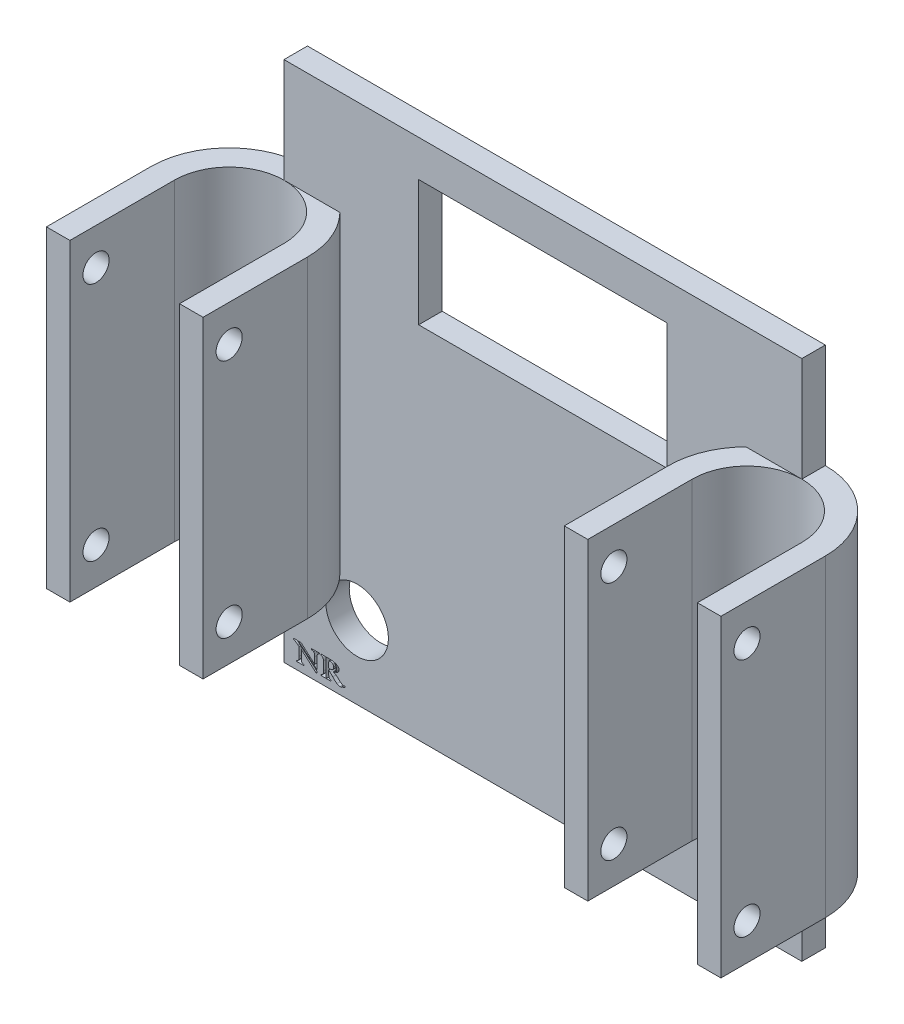
from build123d import *

# Parameters (mm, degrees)
SKETCH4_R               = 15
SKETCH4_R_2             = 10.5
BOSS_EXTRUDE3_DEPTH     = 60
BOSS_EXTRUDE3_2_DEPTH   = 60
BOSS_EXTRUDE4_START     = 30
SKETCH5_W               = 99.189569717
SKETCH5_H               = 4.5
BOSS_EXTRUDE4_DEPTH     = 50
SKETCH6_W               = 135.750478206
SKETCH6_H               = 17.20014076
CUT_EXTRUDE1_DEPTH      = 95
SKETCH9_W               = 4.5
SKETCH9_H               = 20
BOSS_EXTRUDE5_DEPTH     = 60
CUT_EXTRUDE4_DEPTH      = 141.85190035
CUT_EXTRUDE4_DEPTH_BACK = 141.85190035
SKETCH10_R              = 2.5
SKETCH11_W              = 99.189569717
SKETCH11_H              = 4.5
BOSS_EXTRUDE6_DEPTH     = 50
CUT_EXTRUDE6_START      = -2
CUT_EXTRUDE6_DEPTH      = 2
SKETCH14_R              = 6
CUT_EXTRUDE7_DEPTH      = 144.75067947
SKETCH15_W              = 47.6
SKETCH15_H              = 24.1
CUT_EXTRUDE8_DEPTH      = 144.75067947


# Read off the part's stored shape, not the designer's step: Cut-Extrude6
with BuildPart() as part:
    # Sketch4 → Boss-Extrude3 (new body)
    with BuildSketch(Plane(origin=(0, 0, 0), x_dir=(1, 0, 0), z_dir=(0, 1, 0))):
        with Locations(Location((0, 0, 0), (0, 0, 270))):
            Circle(SKETCH4_R)
        with Locations(Location((0, 0, 0), (0, 0, 270))):
            Circle(SKETCH4_R_2, mode=Mode.SUBTRACT)
    extrude(amount=BOSS_EXTRUDE3_DEPTH)



with BuildPart() as body_2:
    # Sketch4 → Boss-Extrude3 2 (new body)
    with BuildSketch(Plane(origin=(0, 0, 0), x_dir=(1, 0, 0), z_dir=(0, 1, 0))):
        with Locations(Location((99.189569717, 0, 0), (0, 0, 270))):
            Circle(SKETCH4_R)
        with Locations(Location((99.189569717, 0, 0), (0, 0, 270))):
            Circle(SKETCH4_R_2, mode=Mode.SUBTRACT)
    extrude(amount=BOSS_EXTRUDE3_2_DEPTH)


with BuildPart() as part_1:
    add(part.part)

    add(body_2.part)  # Boss-Extrude4 merges body 2
    # Sketch5 → Boss-Extrude4 (add)
    with BuildSketch(Plane(origin=(0, 0, 0), x_dir=(1, 0, 0), z_dir=(0, 1, 0)).offset(BOSS_EXTRUDE4_START)):
        with Locations((49.594784859, 12.75)):
            Rectangle(SKETCH5_W, SKETCH5_H)
    extrude(amount=BOSS_EXTRUDE4_DEPTH)

    # Sketch6 → Cut-Extrude1 (cut)
    with BuildSketch(Plane(origin=(0, 0, 0), x_dir=(1, 0, 0), z_dir=(0, 1, 0))):
        with Locations((50.045783125, -8.60007038)):
            Rectangle(SKETCH6_W, SKETCH6_H)
    extrude(amount=CUT_EXTRUDE1_DEPTH, mode=Mode.SUBTRACT)

    # Sketch9 → Boss-Extrude5 (add)
    with BuildSketch(Plane(origin=(0, 0, 0), x_dir=(1, 0, 0), z_dir=(0, 1, 0))):
        with Locations((-12.75, -10)):
            Rectangle(SKETCH9_W, SKETCH9_H)
        with Locations((12.75, -10)):
            Rectangle(SKETCH9_W, SKETCH9_H)
        with Locations((86.439569717, -10)):
            Rectangle(SKETCH9_W, SKETCH9_H)
        with Locations((111.939569717, -10)):
            Rectangle(SKETCH9_W, SKETCH9_H)
    extrude(amount=BOSS_EXTRUDE5_DEPTH)

    # Sketch10 → Cut-Extrude4 (cut, two sides: drawn at the far end of the back side and taken through both)
    with BuildSketch(Plane(origin=(0, 0, 0), x_dir=(0, 0, -1), z_dir=(1, 0, 0)).offset(-CUT_EXTRUDE4_DEPTH_BACK)):
        with Locations((-15, 7)):
            Circle(SKETCH10_R)
        with Locations((-15, 53)):
            Circle(SKETCH10_R)
    extrude(amount=CUT_EXTRUDE4_DEPTH + CUT_EXTRUDE4_DEPTH_BACK, mode=Mode.SUBTRACT)

    # Sketch11 → Boss-Extrude6 (add)
    with BuildSketch(Plane(origin=(0, 30, 0), x_dir=(1, 0, 0), z_dir=(0, 1, 0))):
        with Locations((49.594784859, 12.75)):
            Rectangle(SKETCH11_W, SKETCH11_H)
    extrude(amount=-BOSS_EXTRUDE6_DEPTH)

    # Cut-Extrude6 outline → Cut-Extrude6 (cut)
    # profile 1 of 5: a face of its own
    with BuildSketch(Plane.XY.offset(-10.5).offset(CUT_EXTRUDE6_START)):
        with BuildLine():
            add(Edge.make_bspline(
                [(6.3515625, -15.60453826), (6.345631349, -15.631157613), (6.332487853, -15.690146389), (6.320396673, -15.789771031), (6.314484465, -15.908498662), (6.313192302, -15.994179811), (6.3125, -16.040085135)],
                knots=[0, 0, 0, 0, 0.186590684, 0.413486984, 0.685764369, 1, 1, 1, 1], degree=3))
            add(Edge.make_bspline(
                [(6.483398437, -15.369186698), (6.46952702, -15.383075067), (6.440686672, -15.41195066), (6.405732103, -15.466705429), (6.374133474, -15.531010922), (6.359338849, -15.57920598), (6.3515625, -15.60453826)],
                knots=[0, 0, 0, 0, 0.215051393, 0.44711775, 0.709394108, 1, 1, 1, 1], degree=3))
            add(Edge.make_bspline(
                [(6.8203125, -15.232467948), (6.785601719, -15.238073767), (6.719446671, -15.248757859), (6.628003017, -15.278147165), (6.548443545, -15.316865), (6.504660563, -15.352083636), (6.483398437, -15.369186698)],
                knots=[0, 0, 0, 0, 0.285568369, 0.544262867, 0.778682495, 1, 1, 1, 1], degree=3))
            Line((6.8203125, -15.232467948), (6.8203125, -15.059616385))
            Line((6.8203125, -15.059616385), (5.2890625, -15.059616385))
            Line((5.2890625, -15.059616385), (5.2890625, -15.238327323))
            add(Edge.make_bspline(
                [(5.666992187, -15.379928885), (5.644052863, -15.363450717), (5.59524696, -15.328391625), (5.506543527, -15.290923841), (5.403364725, -15.259639419), (5.328635231, -15.245705813), (5.2890625, -15.238327323)],
                knots=[0, 0, 0, 0, 0.207298771, 0.441050639, 0.704010409, 1, 1, 1, 1], degree=3))
            add(Edge.make_bspline(
                [(5.831054687, -15.629928885), (5.823818555, -15.605789683), (5.809404864, -15.557706673), (5.771655847, -15.492254301), (5.725816074, -15.430860575), (5.686900719, -15.397166358), (5.666992187, -15.379928885)],
                knots=[0, 0, 0, 0, 0.247818207, 0.493630433, 0.740948671, 1, 1, 1, 1], degree=3))
            add(Edge.make_bspline(
                [(5.875, -16.122116385), (5.874429575, -16.071646168), (5.873357877, -15.976824163), (5.865830277, -15.844178892), (5.853502978, -15.730025017), (5.838114479, -15.661408245), (5.831054687, -15.629928885)],
                knots=[0, 0, 0, 0, 0.305688975, 0.574319731, 0.8047104, 1, 1, 1, 1], degree=3))
            Line((5.875, -16.122116385), (5.875, -17.378952323))
            Line((5.875, -17.378952323), (3.265625, -15.059616385))
            Line((3.265625, -15.059616385), (2.764648437, -15.059616385))
            Line((2.764648437, -15.059616385), (6.3125, -18.035202323))
            Line((6.3125, -18.035202323), (6.3125, -16.040085135))
        make_face()
    # profile 2 of 5: a face of its own
    with BuildSketch(Plane.XY.offset(-10.5).offset(CUT_EXTRUDE6_START)):
        with BuildLine():
            add(Edge.make_bspline(
                [(8.5625, -17.669967948), (8.563397151, -17.726387964), (8.565085748, -17.832580456), (8.588343195, -17.981860375), (8.622650483, -18.111816294), (8.673977879, -18.221796105), (8.739482285, -18.312489061), (8.822773417, -18.380334095), (8.919308009, -18.430694082), (8.991282612, -18.44424482), (9.028320312, -18.451217948)],
                knots=[0, 0, 0, 0, 0.168548207, 0.317237666, 0.450688369, 0.569132173, 0.678356261, 0.782057148, 0.887847914, 1, 1, 1, 1], degree=3))
            Line((8.5625, -17.669967948), (8.5625, -16.977585135))
            add(Edge.make_bspline(
                [(8.784179687, -17.177780448), (8.755584471, -17.155634395), (8.704531752, -17.116095745), (8.640213978, -17.059580229), (8.592253218, -17.017205399), (8.571004036, -16.98890936), (8.5625, -16.977585135)],
                knots=[0, 0, 0, 0, 0.362010432, 0.646318482, 0.858454774, 1, 1, 1, 1], degree=3))
            add(Edge.make_bspline(
                [(9.344726562, -17.724655448), (9.314451662, -17.692756406), (9.255964997, -17.631132138), (9.171673618, -17.542261669), (9.09222344, -17.462185913), (9.019169286, -17.389708939), (8.95165946, -17.325730377), (8.891584973, -17.268145617), (8.835478358, -17.220842227), (8.80045926, -17.191446052), (8.784179687, -17.177780448)],
                knots=[0, 0, 0, 0, 0.168359555, 0.325245947, 0.468878017, 0.600174077, 0.719160284, 0.824958423, 0.918627204, 1, 1, 1, 1], degree=3))
            add(Edge.make_bspline(
                [(10.137695312, -18.450241385), (10.114123667, -18.433496406), (10.063899127, -18.397817567), (9.986651862, -18.336911868), (9.903027037, -18.265083599), (9.810231311, -18.183762537), (9.709173023, -18.088761736), (9.596899982, -17.980640597), (9.474238374, -17.857501923), (9.389237021, -17.77031196), (9.344726562, -17.724655448)],
                knots=[0, 0, 0, 0, 0.080583134, 0.171699974, 0.274050387, 0.387827793, 0.515579673, 0.660597754, 0.82227401, 1, 1, 1, 1], degree=3))
            add(Edge.make_bspline(
                [(10.723632812, -18.622116385), (10.669088822, -18.620185), (10.562578647, -18.616413508), (10.408895777, -18.583096135), (10.265364173, -18.530087602), (10.180208763, -18.47683), (10.137695312, -18.450241385)],
                knots=[0, 0, 0, 0, 0.263710864, 0.51495848, 0.757845231, 1, 1, 1, 1], degree=3))
            Line((10.723632812, -18.622116385), (11.067382812, -18.622116385))
            Line((11.067382812, -18.622116385), (11.067382813, -18.437399493))
            add(Edge.make_bspline(
                [(11.251953125, -18.459030448), (11.206802868, -18.456719383), (11.14469187, -18.453540165), (11.083877454, -18.441304684), (11.067382813, -18.437399493)],
                knots=[0, 0, 0, 0, 0.229231469, 0.315342507, 0.315342507, 0.315342507, 0.315342507], degree=3))
            add(Edge.make_bspline(
                [(11.734375, -18.239303885), (11.719530306, -18.256994046), (11.690432532, -18.291669351), (11.639417911, -18.335689768), (11.585764933, -18.374120034), (11.527679402, -18.406099588), (11.464200022, -18.428976607), (11.397333756, -18.446953761), (11.325783387, -18.456416283), (11.277041826, -18.458142113), (11.251953125, -18.459030448)],
                knots=[0, 0, 0, 0, 0.125855176, 0.246694577, 0.36648455, 0.485733112, 0.607171829, 0.733864423, 0.863012266, 1, 1, 1, 1], degree=3))
            Line((11.734375, -18.239303885), (11.693359375, -18.107467948))
            add(Edge.make_bspline(
                [(11.432617187, -18.16313201), (11.445984683, -18.162006144), (11.478450625, -18.159271727), (11.535282332, -18.148907004), (11.608659675, -18.130614531), (11.663119404, -18.115731873), (11.693359375, -18.107467948)],
                knots=[0, 0, 0, 0, 0.15063036, 0.365839412, 0.647868288, 1, 1, 1, 1], degree=3))
            add(Edge.make_bspline(
                [(10.491210937, -17.55766326), (10.540243032, -17.605347402), (10.633936301, -17.696464927), (10.774643692, -17.818946171), (10.904995171, -17.924577194), (11.027427959, -18.009931152), (11.140424434, -18.07775467), (11.245299338, -18.124873645), (11.341308128, -18.156367809), (11.403449068, -18.160971228), (11.432617187, -18.16313201)],
                knots=[0, 0, 0, 0, 0.179896186, 0.343755691, 0.490604525, 0.621025589, 0.736174311, 0.836603195, 0.923303743, 1, 1, 1, 1], degree=3))
            add(Edge.make_bspline(
                [(9.838867187, -16.996139823), (9.859767943, -17.010692561), (9.903964189, -17.041465438), (9.972389596, -17.092132912), (10.045591782, -17.151250339), (10.124647777, -17.217367705), (10.20860109, -17.292032972), (10.298099792, -17.373773928), (10.393178532, -17.462957327), (10.457764016, -17.525351272), (10.491210937, -17.55766326)],
                knots=[0, 0, 0, 0, 0.088657667, 0.187473416, 0.296313356, 0.416159235, 0.546215408, 0.687388189, 0.838107544, 1, 1, 1, 1], degree=3))
            add(Edge.make_bspline(
                [(9.412109375, -16.857467948), (9.449079361, -16.85983895), (9.523326381, -16.864600647), (9.632025876, -16.893890065), (9.73929676, -16.935041492), (9.805242518, -16.975507078), (9.838867187, -16.996139823)],
                knots=[0, 0, 0, 0, 0.244059444, 0.490145877, 0.740033674, 1, 1, 1, 1], degree=3))
            add(Edge.make_bspline(
                [(9.98828125, -16.02641326), (9.98685611, -16.081875922), (9.984137099, -16.187692577), (9.956691244, -16.33741571), (9.911760326, -16.469727256), (9.849371555, -16.585266616), (9.766340762, -16.682285926), (9.664630887, -16.760166234), (9.545450468, -16.821065128), (9.457598062, -16.845049297), (9.412109375, -16.857467948)],
                knots=[0, 0, 0, 0, 0.150141985, 0.286454384, 0.410571848, 0.527416482, 0.640009802, 0.753795419, 0.87251888, 1, 1, 1, 1], degree=3))
            add(Edge.make_bspline(
                [(9.734375, -15.326217948), (9.754668044, -15.351606955), (9.794812378, -15.401832281), (9.846812014, -15.482106978), (9.88954581, -15.565940017), (9.92647552, -15.651694819), (9.953346418, -15.741656127), (9.97424404, -15.833879925), (9.986033235, -15.929428109), (9.987526024, -15.993830881), (9.98828125, -16.02641326)],
                knots=[0, 0, 0, 0, 0.128134595, 0.253479859, 0.376355154, 0.498908118, 0.6211379, 0.74604191, 0.871518591, 1, 1, 1, 1], degree=3))
            add(Edge.make_bspline(
                [(8.987304687, -15.059616385), (9.028685013, -15.060211873), (9.108726652, -15.061363721), (9.224280495, -15.074549033), (9.331324792, -15.094434534), (9.429680846, -15.123581097), (9.519216959, -15.162103009), (9.600487091, -15.207668979), (9.673455694, -15.261575146), (9.714134947, -15.304740787), (9.734375, -15.326217948)],
                knots=[0, 0, 0, 0, 0.151720092, 0.293470983, 0.426016387, 0.550679314, 0.668896719, 0.78278972, 0.891926543, 1, 1, 1, 1], degree=3))
            Line((8.987304687, -15.059616385), (8.091796875, -15.059616385))
            Line((8.091796875, -15.059616385), (8.091796875, -18.622116385))
            Line((8.091796875, -18.622116385), (9.028320312, -18.622116385))
            Line((9.028320312, -18.622116385), (9.028320312, -18.451217948))
        make_face()
        with BuildLine():
            add(Edge.make_bspline(
                [(8.611328125, -15.42094451), (8.607123833, -15.431596288), (8.597283214, -15.456527973), (8.588879899, -15.501446506), (8.581112496, -15.557825756), (8.574663201, -15.62562993), (8.568568186, -15.705364279), (8.564954741, -15.796565878), (8.563249487, -15.899778631), (8.562759342, -15.972376092), (8.5625, -16.01078826)],
                knots=[0, 0, 0, 0, 0.057712962, 0.135083694, 0.229686179, 0.345310861, 0.478805882, 0.633442567, 0.806050159, 1, 1, 1, 1], degree=3))
            add(Edge.make_bspline(
                [(8.8515625, -15.372116385), (8.824828839, -15.372570202), (8.775747421, -15.373403383), (8.708575615, -15.381849259), (8.653605474, -15.395892101), (8.624412851, -15.413190857), (8.611328125, -15.42094451)],
                knots=[0, 0, 0, 0, 0.322469882, 0.592035604, 0.817142069, 1, 1, 1, 1], degree=3))
            add(Edge.make_bspline(
                [(9.5, -16.004928885), (9.498439131, -15.955278498), (9.495488896, -15.861433121), (9.465392189, -15.730251184), (9.414345729, -15.61832598), (9.341095988, -15.526851217), (9.247205683, -15.455592261), (9.132873858, -15.405725841), (8.99848647, -15.376856385), (8.902495022, -15.373759549), (8.8515625, -15.372116385)],
                knots=[0, 0, 0, 0, 0.143211211, 0.270686912, 0.385926801, 0.495606096, 0.605607269, 0.723020253, 0.853036107, 1, 1, 1, 1], degree=3))
            add(Edge.make_bspline(
                [(8.845703125, -16.684616385), (8.897009074, -16.682851428), (8.993936202, -16.679517072), (9.1292356, -16.647008774), (9.245133188, -16.594067329), (9.340884044, -16.518281701), (9.413956639, -16.418908026), (9.46402294, -16.298683311), (9.495957469, -16.158587453), (9.498598953, -16.058183373), (9.5, -16.004928885)],
                knots=[0, 0, 0, 0, 0.142183618, 0.268613096, 0.383389279, 0.493297983, 0.603695699, 0.721846155, 0.852466745, 1, 1, 1, 1], degree=3))
            add(Edge.make_bspline(
                [(8.5625, -16.66313201), (8.579372035, -16.666770468), (8.617042675, -16.67489415), (8.681634384, -16.678908037), (8.759007008, -16.684953282), (8.815409326, -16.684734106), (8.845703125, -16.684616385)],
                knots=[0, 0, 0, 0, 0.181724482, 0.405741082, 0.680822339, 1, 1, 1, 1], degree=3))
            Line((8.5625, -16.66313201), (8.5625, -16.01078826))
        make_face(mode=Mode.SUBTRACT)
    # profile 3 of 5: a face of its own
    with BuildSketch(Plane.XY.offset(-10.5).offset(CUT_EXTRUDE6_START)):
        with BuildLine():
            add(Edge.make_bspline(
                [(7.5625, -15.976608573), (7.561107103, -15.925734994), (7.55846667, -15.829296972), (7.536044535, -15.692975096), (7.49938719, -15.573240288), (7.447861072, -15.469451926), (7.378907, -15.383183849), (7.294468315, -15.315071376), (7.195134158, -15.263471916), (7.121936962, -15.244983723), (7.083984375, -15.235397635)],
                knots=[0, 0, 0, 0, 0.157673595, 0.298892472, 0.426911519, 0.544735125, 0.656030538, 0.76654044, 0.878951727, 1, 1, 1, 1], degree=3))
            Line((7.5625, -15.976608573), (7.5625, -17.610397635))
            add(Edge.make_bspline(
                [(7.439453125, -18.259811698), (7.449781043, -18.245154134), (7.47181411, -18.213884415), (7.494927254, -18.156584241), (7.516454211, -18.090455105), (7.533953582, -18.013994609), (7.545851833, -17.927357418), (7.555761755, -17.830964883), (7.561492739, -17.72407272), (7.562153813, -17.649466849), (7.5625, -17.610397635)],
                knots=[0, 0, 0, 0, 0.080018204, 0.170706855, 0.2748423, 0.391478775, 0.521090328, 0.666071853, 0.82513025, 1, 1, 1, 1], degree=3))
            add(Edge.make_bspline(
                [(7.083984375, -18.441452323), (7.12152572, -18.436250114), (7.193226342, -18.426314358), (7.290408329, -18.385954645), (7.376352122, -18.334285946), (7.41847767, -18.284567742), (7.439453125, -18.259811698)],
                knots=[0, 0, 0, 0, 0.275806003, 0.526764882, 0.76436338, 1, 1, 1, 1], degree=3))
            Line((7.083984375, -18.441452323), (7.083984375, -18.622116385))
            Line((7.083984375, -18.622116385), (8.030273437, -18.622116385))
            Line((8.030273437, -18.622116385), (8.030273437, -15.059616385))
            Line((8.030273437, -15.059616385), (7.083984375, -15.059616385))
            Line((7.083984375, -15.059616385), (7.083984375, -15.235397635))
        make_face()
    # profile 4 of 5: a face of its own
    with BuildSketch(Plane.XY.offset(-10.5).offset(CUT_EXTRUDE6_START)):
        with BuildLine():
            add(Edge.make_bspline(
                [(10.5625, -15.988327323), (10.560330194, -16.031226626), (10.556082756, -16.115202875), (10.519932703, -16.236204536), (10.46282731, -16.34815805), (10.381389788, -16.450347361), (10.277254077, -16.542874181), (10.149259517, -16.6237372), (10.001007178, -16.699310947), (9.891502257, -16.737696443), (9.833984375, -16.757858573)],
                knots=[0, 0, 0, 0, 0.112771396, 0.22075228, 0.329637948, 0.441968606, 0.562781617, 0.694746944, 0.839664657, 1, 1, 1, 1], degree=3))
            add(Edge.make_bspline(
                [(9.80078125, -15.199264823), (9.860797462, -15.221957306), (9.974760726, -15.265047487), (10.130828144, -15.343224808), (10.262932406, -15.430134628), (10.372246313, -15.524823609), (10.457251634, -15.628804055), (10.518198607, -15.741254683), (10.556182972, -15.862216957), (10.560383051, -15.946065489), (10.5625, -15.988327323)],
                knots=[0, 0, 0, 0, 0.163885981, 0.31119894, 0.445006974, 0.567000094, 0.679371719, 0.786187534, 0.892232973, 1, 1, 1, 1], degree=3))
            add(Edge.make_bspline(
                [(10.05078125, -15.978561698), (10.049994446, -15.949879347), (10.048387818, -15.891310925), (10.036033552, -15.802151883), (10.016075009, -15.709580292), (9.989018232, -15.613556157), (9.953188431, -15.514303264), (9.910262765, -15.411914921), (9.859215892, -15.306078979), (9.820634068, -15.235554289), (9.80078125, -15.199264823)],
                knots=[0, 0, 0, 0, 0.104020292, 0.212406036, 0.325888607, 0.447376399, 0.573989741, 0.708422919, 0.849964931, 1, 1, 1, 1], degree=3))
            add(Edge.make_bspline(
                [(9.833984375, -16.757858573), (9.867071309, -16.691457817), (9.931223875, -16.56271277), (9.999801223, -16.364507912), (10.042233783, -16.1701479), (10.047969458, -16.041586273), (10.05078125, -15.978561698)],
                knots=[0, 0, 0, 0, 0.272294565, 0.527954478, 0.768589825, 1, 1, 1, 1], degree=3))
        make_face()
    # profile 5 of 5: a face of its own
    with BuildSketch(Plane.XY.offset(-10.5).offset(CUT_EXTRUDE6_START)):
        with BuildLine():
            add(Edge.make_bspline(
                [(2.66015625, -15.748092948), (2.621312875, -15.715920977), (2.545613982, -15.653223473), (2.431710989, -15.566392117), (2.320761566, -15.489310422), (2.214527303, -15.419282102), (2.111047039, -15.358940276), (2.011667337, -15.306689818), (1.915283782, -15.264214324), (1.851378763, -15.24153834), (1.8203125, -15.230514823)],
                knots=[0, 0, 0, 0, 0.152506411, 0.297208125, 0.432926093, 0.560973898, 0.681851813, 0.794999847, 0.900342905, 1, 1, 1, 1], degree=3))
            Line((2.66015625, -15.748092948), (2.87109375, -15.92485076))
            Line((2.87109375, -15.92485076), (2.875, -17.55375701))
            add(Edge.make_bspline(
                [(2.78125, -18.210983573), (2.789181965, -18.194556525), (2.806036934, -18.159649996), (2.823424539, -18.099796131), (2.840588271, -18.031917541), (2.852230466, -17.953997203), (2.863722928, -17.867174458), (2.869370497, -17.770597841), (2.875119335, -17.665152167), (2.875040812, -17.591853434), (2.875, -17.55375701)],
                knots=[0, 0, 0, 0, 0.081670673, 0.17354547, 0.278701893, 0.395577258, 0.526488217, 0.671369433, 0.829196922, 1, 1, 1, 1], degree=3))
            add(Edge.make_bspline(
                [(2.396484375, -18.447311698), (2.42034164, -18.441463268), (2.466202173, -18.430220903), (2.530822549, -18.408632195), (2.589229382, -18.384347398), (2.640891502, -18.356115927), (2.686285878, -18.324900751), (2.724757299, -18.290533145), (2.75704909, -18.252919934), (2.773198385, -18.224935752), (2.78125, -18.210983573)],
                knots=[0, 0, 0, 0, 0.158135626, 0.303982212, 0.438315319, 0.564969643, 0.682442738, 0.792298757, 0.896445613, 1, 1, 1, 1], degree=3))
            Line((2.396484375, -18.447311698), (2.396484375, -18.622116385))
            Line((2.396484375, -18.622116385), (3.836914062, -18.622116385))
            Line((3.836914062, -18.622116385), (3.836914062, -18.458053885))
            add(Edge.make_bspline(
                [(3.416015625, -18.21781951), (3.438154814, -18.246181995), (3.483998032, -18.304911677), (3.582828416, -18.370391794), (3.700870926, -18.424979553), (3.789823691, -18.446605439), (3.836914062, -18.458053885)],
                knots=[0, 0, 0, 0, 0.216287928, 0.447863489, 0.70770652, 1, 1, 1, 1], degree=3))
            add(Edge.make_bspline(
                [(3.3125, -17.582077323), (3.312896499, -17.62049676), (3.313652876, -17.693787167), (3.318716526, -17.798637575), (3.325731388, -17.893586571), (3.338128352, -17.978102499), (3.350376528, -18.053356473), (3.369678855, -18.117218143), (3.388925301, -18.172490306), (3.407398137, -18.203400198), (3.416015625, -18.21781951)],
                knots=[0, 0, 0, 0, 0.177043986, 0.337735974, 0.483745291, 0.615494636, 0.731424867, 0.834456299, 0.922774676, 1, 1, 1, 1], degree=3))
            Line((3.3125, -17.582077323), (3.3125, -16.166061698))
            Line((3.3125, -16.166061698), (6.100585937, -18.622116385))
            Line((6.100585937, -18.622116385), (6.3125, -18.622116385))
            Line((6.3125, -18.622116385), (6.3125, -18.285202323))
            Line((6.3125, -18.285202323), (2.5234375, -15.059616385))
            Line((2.5234375, -15.059616385), (1.8203125, -15.059616385))
            Line((1.8203125, -15.059616385), (1.8203125, -15.230514823))
        make_face()
    extrude(amount=CUT_EXTRUDE6_DEPTH, mode=Mode.SUBTRACT)

    # Sketch14 → Cut-Extrude7 (cut, through all)
    with BuildSketch(Plane(origin=(0, 0, -15), x_dir=(-1, 0, 0), z_dir=(0, 0, -1))):
        with Locations((-14, -6)):
            Circle(SKETCH14_R)
    extrude(amount=-CUT_EXTRUDE7_DEPTH, mode=Mode.SUBTRACT)

    # Sketch15 → Cut-Extrude8 (cut, through all)
    with BuildSketch(Plane(origin=(0, 0, -15), x_dir=(-1, 0, 0), z_dir=(0, 0, -1))):
        with Locations((-49.594784859, 60.95)):
            Rectangle(SKETCH15_W, SKETCH15_H)
    extrude(amount=-CUT_EXTRUDE8_DEPTH, mode=Mode.SUBTRACT)


solid = part_1.part
